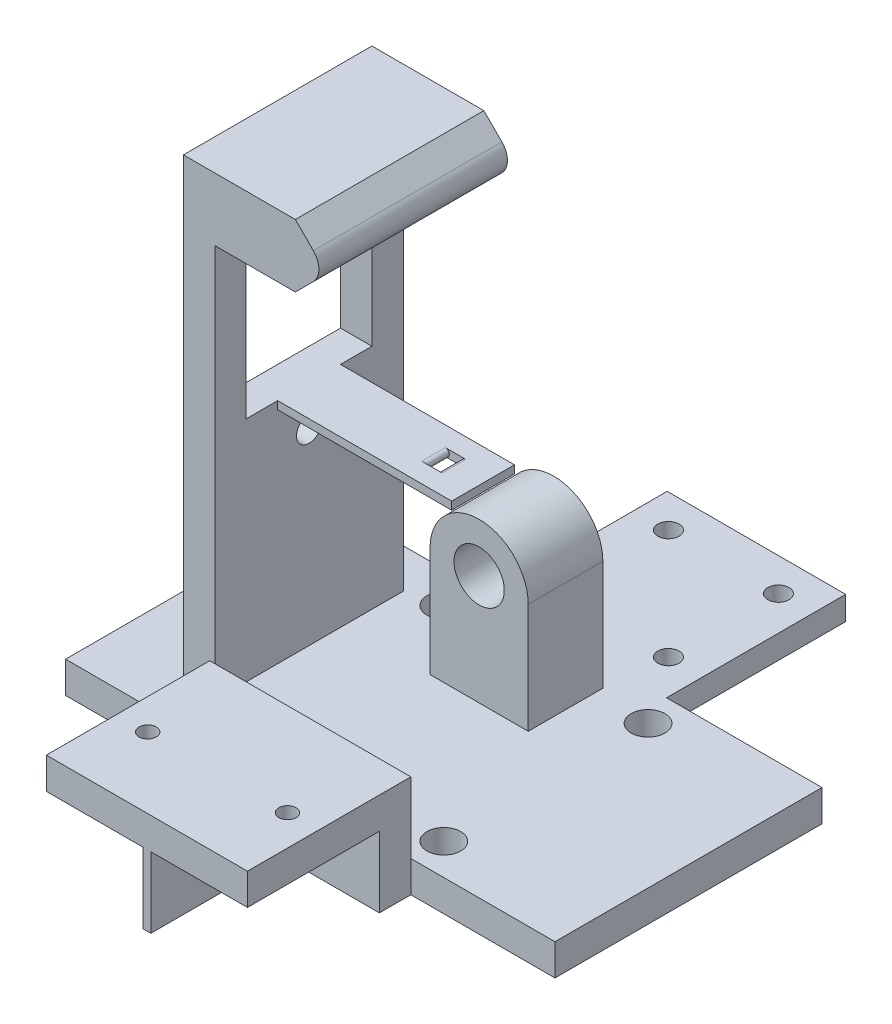
from build123d import *

# Parameters (mm, degrees)
SKETCH_1_W                 = 62.3
SKETCH_1_H                 = 34
EXTRUDE_346_DEPTH          = 4
HOLE_WIZARD_M4_1_D         = 4.3
PATTERN_SKETCH_1_OUTLINE_R = 2.15
PATTERN_SKETCH_1_DEPTH     = 4
SKETCH_6_W                 = 22.72
SKETCH_6_H                 = 3
EXTRUDE_2_DEPTH            = 22.8
HOLE_WIZARD_M2_5_1_D       = 2.7
PATTERN_START              = 1
PATTERN_SKETCH_2_OUTLINE_R = 1.35
PATTERN_SKETCH_2_DEPTH     = 3
SKETCH_11_W                = 25.6
SKETCH_11_H                = 4
EXTRUDE_5_DEPTH            = 4
SKETCH_12_W                = 25.6
SKETCH_12_H                = 4
EXTRUDE_6_DEPTH            = 9
SKETCH_13_W                = 25.6
SKETCH_13_H                = 4
EXTRUDE_7_DEPTH            = 16.8
HOLE_WIZARD_M2_1_D         = 2.2
EXTRUDE_START              = -14
EXTRUDE_8_OUTLINE_W        = 12.5
EXTRUDE_8_OUTLINE_H        = 20.251
EXTRUDE_8_OUTLINE_R        = 0.25
EXTRUDE_8_DEPTH            = 9.5
CUT_EXTRUDE_1_REACH        = 67.128
SKETCH_18_R                = 3.2
FILLET_1_RADIUS            = 6.25
FILLET_1_LENGTH            = 9.5
SKETCH_19_W                = 4
SKETCH_19_H                = 24
EXTRUDE_10_DEPTH           = 29
SKETCH_20_W                = 8
SKETCH_20_H                = 1
EXTRUDE_11_DEPTH           = 22.15
CUT_EXTRUDE_3_REACH        = 62.36
SKETCH_22_W                = 1.6
SKETCH_22_H                = 3
FILLET_2_RADIUS            = 0.5
FILLET_2_LENGTH            = 3
FILLET_3_R                 = 0.5
SKETCH_23_W                = 1
SKETCH_23_H                = 9
EXTRUDE_12_DEPTH           = 16.8
HOLE_WIZARD_M3_1_D         = 3.2
EXTRUDE_START_2            = 29
SKETCH_19_2_W              = 4
SKETCH_19_2_H              = 24
EXTRUDE_17_DEPTH           = 29.1
CUT_EXTRUDE_4_REACH        = 90.167
SKETCH_29_W                = 16
SKETCH_29_H                = 21.1
SKETCH_30_W                = 24
SKETCH_30_H                = 8
EXTRUDE_18_DEPTH           = 13.25
CHAMFER_1_SIZE             = 3
FILLET_4_R                 = 2.414214


# Read off the part's stored shape, not the designer's step: 草图阵列1, 草图阵列2, 凸台-拉伸8
with BuildPart() as part:
    # 草图1 → Extrude 346 (new body)
    with BuildSketch(Plane(origin=(0, 0, 0), x_dir=(1, 0, 0), z_dir=(0, 1, 0))):
        Rectangle(SKETCH_1_W, SKETCH_1_H)
    extrude(amount=EXTRUDE_346_DEPTH)

    # M4 间隙孔1 (through all)
    with Locations(Plane(origin=(0, 4, 0), x_dir=(1, 0, 0), z_dir=(0, 1, 0))):
        with Locations((13, -13)):
            Hole(HOLE_WIZARD_M4_1_D / 2)

    # 草图阵列1 outline → 草图阵列1 (cut)
    with BuildSketch(Plane(origin=(0, 0, 0), x_dir=(1, 0, 0), z_dir=(0, 1, 0))):
        with Locations((-13, 13)):
            Circle(PATTERN_SKETCH_1_OUTLINE_R)
        with Locations((-13, -13)):
            Circle(PATTERN_SKETCH_1_OUTLINE_R)
        with Locations((13, 13)):
            Circle(PATTERN_SKETCH_1_OUTLINE_R)
    extrude(amount=PATTERN_SKETCH_1_DEPTH, mode=Mode.SUBTRACT)

    # 草图6 → 凸台-拉伸2 (add)
    with BuildSketch(Plane(origin=(0, 0, -17), x_dir=(-1, 0, 0), z_dir=(0, 0, -1))):
        with Locations((0, 2.5)):
            Rectangle(SKETCH_6_W, SKETCH_6_H)
    extrude(amount=EXTRUDE_2_DEPTH)

    # M2.5 间隙孔1 (through all)
    with Locations(Plane(origin=(0, 4, 0), x_dir=(1, 0, 0), z_dir=(0, 1, 0))):
        with Locations((-7, 35.6)):
            Hole(HOLE_WIZARD_M2_5_1_D / 2)

    # 草图阵列2 outline → 草图阵列2 (cut)
    with BuildSketch(Plane(origin=(0, 0, 0), x_dir=(1, 0, 0), z_dir=(0, 1, 0)).offset(PATTERN_START)):
        with Locations((7, 21.6)):
            Circle(PATTERN_SKETCH_2_OUTLINE_R)
        with Locations((7, 35.6)):
            Circle(PATTERN_SKETCH_2_OUTLINE_R)
        with Locations((-7, 21.6)):
            Circle(PATTERN_SKETCH_2_OUTLINE_R)
    extrude(amount=PATTERN_SKETCH_2_DEPTH, mode=Mode.SUBTRACT)

    # 草图11 → 凸台-拉伸5 (add)
    with BuildSketch(Plane.XY.offset(17)):
        with Locations((0, 2)):
            Rectangle(SKETCH_11_W, SKETCH_11_H)
    extrude(amount=EXTRUDE_5_DEPTH)

    # 草图12 → 凸台-拉伸6 (add)
    with BuildSketch(Plane(origin=(0, 4, 0), x_dir=(1, 0, 0), z_dir=(0, 1, 0))):
        with Locations((0, -19)):
            Rectangle(SKETCH_12_W, SKETCH_12_H)
    extrude(amount=EXTRUDE_6_DEPTH)

    # 草图13 → 凸台-拉伸7 (add)
    with BuildSketch(Plane.XY.offset(21)):
        with Locations((0, 11)):
            Rectangle(SKETCH_13_W, SKETCH_13_H)
    extrude(amount=EXTRUDE_7_DEPTH)

    # M2 间隙孔1 (through all)
    with Locations(Plane(origin=(0, 9, 0), x_dir=(-1, 0, 0), z_dir=(0, -1, 0))):
        with Locations((8.9, -28.8), (-8.9, -28.8)):
            Hole(HOLE_WIZARD_M2_1_D / 2)

    # 凸台-拉伸8 outline → 凸台-拉伸8 (add)
    with BuildSketch(Plane.XY.offset(EXTRUDE_START)):
        with Locations((0, 14.1255)):
            Rectangle(EXTRUDE_8_OUTLINE_W, EXTRUDE_8_OUTLINE_H)
        with Locations((0, 18)):
            Circle(EXTRUDE_8_OUTLINE_R, mode=Mode.SUBTRACT)
    extrude(amount=EXTRUDE_8_DEPTH)

    # 草图18 → 切除-拉伸1 (cut, up to next)
    with BuildSketch(Plane(origin=(0, 0, -14), x_dir=(-1, 0, 0), z_dir=(0, 0, -1)), mode=Mode.PRIVATE) as cut_extrude_1_sk1:
        with Locations((0, 18)):
            Circle(SKETCH_18_R)
    cut_extrude_1_tool1 = extrude(cut_extrude_1_sk1.sketch, amount=-CUT_EXTRUDE_1_REACH, mode=Mode.PRIVATE) & part.part
    add(cut_extrude_1_tool1.solids().sort_by_distance((0, 18, -14))[0], mode=Mode.SUBTRACT)

    # 圆角1: full round fillet: the end face becomes a half cylinder, R = half its width
    fillet_1_face = Plane((0, 24.251, -9.25), x_dir=(0, 0, -1), z_dir=(0, 1, 0))  # on the end face: x along it, z out of the body
    fillet_1_slab = fillet_1_face.offset(-FILLET_1_RADIUS / 2) * Box(FILLET_1_LENGTH, 2 * FILLET_1_RADIUS, FILLET_1_RADIUS, mode=Mode.PRIVATE)  # the body's end, R deep
    fillet_1_round = Plane((0, 18.001, -9.25), x_dir=(0, 1, 0), z_dir=(0, 0, -1)) * Cylinder(FILLET_1_RADIUS, FILLET_1_LENGTH, mode=Mode.PRIVATE)  # its axis R under the face
    add(fillet_1_slab - fillet_1_round, mode=Mode.SUBTRACT)

    # 草图19 → 凸台-拉伸10 (add)
    with BuildSketch(Plane(origin=(0, 4, 0), x_dir=(1, 0, 0), z_dir=(0, 1, 0))):
        with Locations((-19.15, 0)):
            Rectangle(SKETCH_19_W, SKETCH_19_H)
    extrude(amount=EXTRUDE_10_DEPTH)

    # 草图20 → 凸台-拉伸11 (add)
    with BuildSketch(Plane(origin=(-17.15, 0, 0), x_dir=(0, 0, -1), z_dir=(1, 0, 0))):
        with Locations((0, 32.5)):
            Rectangle(SKETCH_20_W, SKETCH_20_H)
    extrude(amount=EXTRUDE_11_DEPTH)

    # 草图22 → 切除-拉伸3 (cut, up to next)
    with BuildSketch(Plane(origin=(0, 33, 0), x_dir=(1, 0, 0), z_dir=(0, 1, 0)), mode=Mode.PRIVATE) as cut_extrude_3_sk1:
        Rectangle(SKETCH_22_W, SKETCH_22_H)
    cut_extrude_3_tool1 = extrude(cut_extrude_3_sk1.sketch, amount=-CUT_EXTRUDE_3_REACH, mode=Mode.PRIVATE) & part.part
    add(cut_extrude_3_tool1.solids().sort_by_distance((0, 33, 0))[0], mode=Mode.SUBTRACT)

    # 圆角2: full round fillet: the end face becomes a half cylinder, R = half its width
    fillet_2_face = Plane((-0.8, 32.5, 0), x_dir=(0, 0, -1), z_dir=(1, 0, 0))  # on the end face: x along it, z out of the body
    fillet_2_slab = fillet_2_face.offset(-FILLET_2_RADIUS / 2) * Box(FILLET_2_LENGTH, 2 * FILLET_2_RADIUS, FILLET_2_RADIUS, mode=Mode.PRIVATE)  # the body's end, R deep
    fillet_2_round = Plane((-1.3, 32.5, 0), x_dir=(1, 0, 0), z_dir=(0, 0, -1)) * Cylinder(FILLET_2_RADIUS, FILLET_2_LENGTH, mode=Mode.PRIVATE)  # its axis R under the face
    add(fillet_2_slab - fillet_2_round, mode=Mode.SUBTRACT)

    # 圆角3
    fillet_3_edges = [part.edges().sort_by_distance(p)[0] for p in [
        (0.8, 33, 0),
    ]]
    fillet(fillet_3_edges, radius=FILLET_3_R)

    # 草图23 → 凸台-拉伸12 (add)
    with BuildSketch(Plane.XY.offset(21)):
        with Locations((0, 4.5)):
            Rectangle(SKETCH_23_W, SKETCH_23_H)
    extrude(amount=EXTRUDE_12_DEPTH)

    # M3 间隙孔1 (through all)
    with Locations(Plane(origin=(-17.15, 0, 0), x_dir=(0, 0, -1), z_dir=(1, 0, 0))):
        with Locations((0, 27.9)):
            Hole(HOLE_WIZARD_M3_1_D / 2)

    # 草图19<2> → 凸台-拉伸17 (add)
    with BuildSketch(Plane(origin=(0, 4, 0), x_dir=(1, 0, 0), z_dir=(0, 1, 0)).offset(EXTRUDE_START_2)):
        with Locations((-19.15, 0)):
            Rectangle(SKETCH_19_2_W, SKETCH_19_2_H)
    extrude(amount=EXTRUDE_17_DEPTH)

    # 草图29 → 切除-拉伸4 (cut, up to next)
    with BuildSketch(Plane(origin=(-17.15, 0, 0), x_dir=(0, 0, -1), z_dir=(1, 0, 0)), mode=Mode.PRIVATE) as cut_extrude_4_sk1:
        with Locations((0, 43.55)):
            Rectangle(SKETCH_29_W, SKETCH_29_H)
    cut_extrude_4_tool1 = extrude(cut_extrude_4_sk1.sketch, amount=-CUT_EXTRUDE_4_REACH, mode=Mode.PRIVATE) & part.part
    add(cut_extrude_4_tool1.solids().sort_by_distance((-17.15, 43.55, 0))[0], mode=Mode.SUBTRACT)

    # 草图30 → 凸台-拉伸18 (add)
    with BuildSketch(Plane(origin=(-17.15, 0, 0), x_dir=(0, 0, -1), z_dir=(1, 0, 0))):
        with Locations((0, 58.1)):
            Rectangle(SKETCH_30_W, SKETCH_30_H)
    extrude(amount=EXTRUDE_18_DEPTH)

    # 倒角1
    chamfer_1_edges = [part.edges().sort_by_distance(p)[0] for p in [
        (-3.9, 62.1, 0),
        (-3.9, 54.1, 0),
    ]]
    chamfer(chamfer_1_edges, length=CHAMFER_1_SIZE)

    # 圆角4
    fillet_4_edges = [part.edges().sort_by_distance(p)[0] for p in [
        (-3.9, 57.1, 0),
        (-3.9, 59.1, 0),
    ]]
    fillet(fillet_4_edges, radius=FILLET_4_R - 0.0001)  # a hair under: the kernel refuses the full size


solid = part.part
